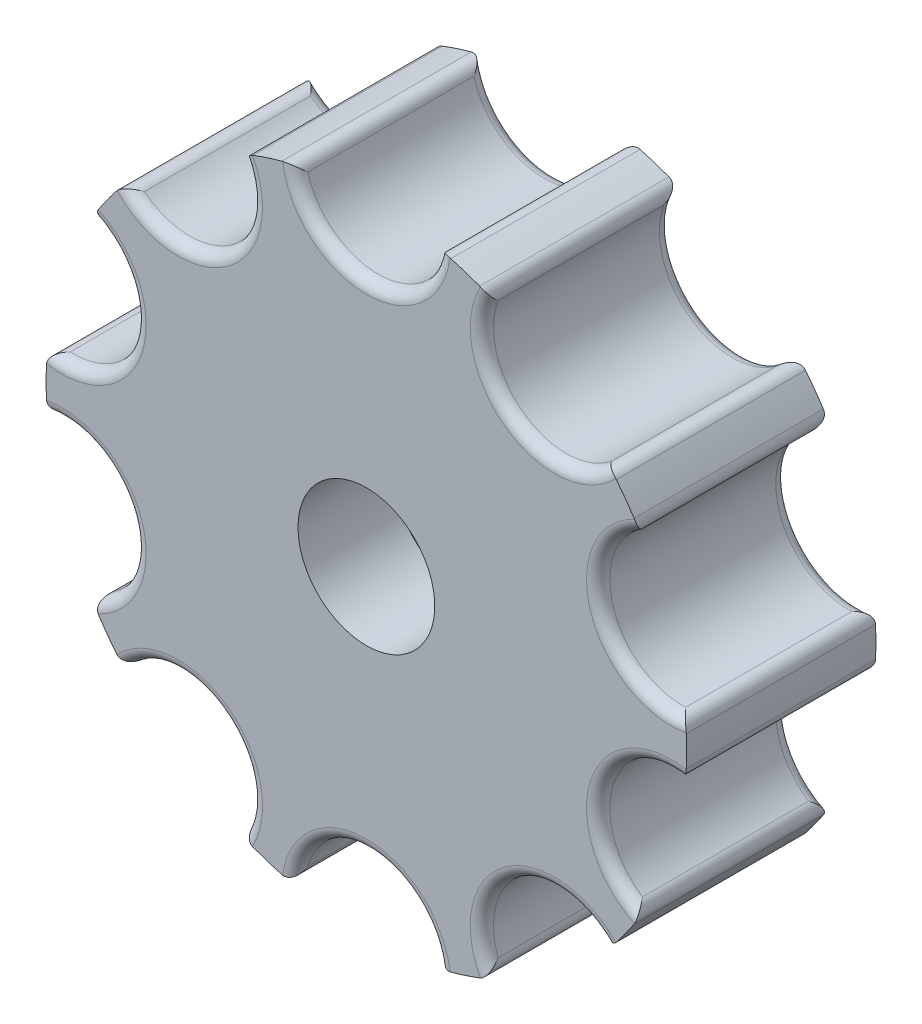
from build123d import *

# Parameters (mm, degrees)
SKETCH1_R           = 11
SKETCH1_R_2         = 2.35
BOSS_EXTRUDE1_DEPTH = 6.5
SKETCH2_R           = 2.5
CUT_EXTRUDE1_DEPTH  = 7.5
FILLET1_R           = 0.4
CUT_EXTRUDE2_DEPTH  = 3.2


with BuildPart() as part:
    # Sketch1 → Boss-Extrude1 (new body)
    with BuildSketch(Plane.XY):
        Circle(SKETCH1_R)
        Circle(SKETCH1_R_2, mode=Mode.SUBTRACT)
    extrude(amount=BOSS_EXTRUDE1_DEPTH)

    # Sketch2 → Cut-Extrude1 (cut)
    with BuildSketch(Plane.XY.offset(6.5)):
        with Locations((0, -11)):
            Circle(SKETCH2_R)
        with Locations((-6.465637775, -8.899186938)):
            Circle(SKETCH2_R)
        with Locations((-10.461621679, -3.399186938)):
            Circle(SKETCH2_R)
        with Locations((-10.461621679, 3.399186938)):
            Circle(SKETCH2_R)
        with Locations((-6.465637775, 8.899186938)):
            Circle(SKETCH2_R)
        with Locations((0, 11)):
            Circle(SKETCH2_R)
        with Locations((6.465637775, 8.899186938)):
            Circle(SKETCH2_R)
        with Locations((10.461621679, 3.399186938)):
            Circle(SKETCH2_R)
        with Locations((10.461621679, -3.399186938)):
            Circle(SKETCH2_R)
        with Locations((6.465637775, -8.899186938)):
            Circle(SKETCH2_R)
    extrude(amount=-CUT_EXTRUDE1_DEPTH, mode=Mode.SUBTRACT)

    # Fillet1
    fillet1_edges = [part.edges().sort_by_distance(p)[0] for p in [
        (-9.423896897, 5.673637922, 3.25),
        (-8.083980389, 2.626644452, 6.5),
        (-10.95897344, 0.949158117, 3.25),
        (-8.083980389, 2.626644452, 0),
        (-4.289212046, 10.129297114, 3.25),
        (-4.996174644, 6.876644452, 6.5),
        (-8.308094611, 7.209408015, 3.25),
        (-4.996174644, 6.876644452, 0),
        (2.483806022, 10.715909091, 3.25),
        (0, 8.5, 6.5),
        (-2.483806022, 10.715909091, 3.25),
        (0, 8.5, 0),
        (10.95897344, 0.949158117, 3.25),
        (8.083980389, 2.626644452, 6.5),
        (9.423896897, 5.673637922, 3.25),
        (8.083980389, 2.626644452, 0),
        (9.423896897, -5.673637922, 3.25),
        (8.083980389, -2.626644452, 6.5),
        (10.95897344, -0.949158117, 3.25),
        (8.083980389, -2.626644452, 0),
        (4.289212046, -10.129297114, 3.25),
        (4.996174644, -6.876644452, 6.5),
        (8.308094611, -7.209408015, 3.25),
        (4.996174644, -6.876644452, 0),
        (8.308094611, 7.209408015, 3.25),
        (4.996174644, 6.876644452, 6.5),
        (4.289212046, 10.129297114, 3.25),
        (4.996174644, 6.876644452, 0),
        (-2.483806022, -10.715909091, 3.25),
        (0, -8.5, 6.5),
        (2.483806022, -10.715909091, 3.25),
        (0, -8.5, 0),
        (-8.308094611, -7.209408015, 3.25),
        (-4.996174644, -6.876644452, 6.5),
        (-4.289212046, -10.129297114, 3.25),
        (-4.996174644, -6.876644452, 0),
        (-10.95897344, -0.949158117, 3.25),
        (-8.083980389, -2.626644452, 6.5),
        (-9.423896897, -5.673637922, 3.25),
        (-8.083980389, -2.626644452, 0),
    ]]
    fillet(fillet1_edges, radius=FILLET1_R)

    # Sketch3 → Cut-Extrude2 (cut)
    with BuildSketch(Plane(origin=(0, 0, 0), x_dir=(-1, 0, 0), z_dir=(0, 0, -1))):
        Polygon((4.330127019, 0), (2.165063509, 3.75), (-2.165063509, 3.75), (-4.330127019, 0), (-2.165063509, -3.75), (2.165063509, -3.75), align=None)
    extrude(amount=-CUT_EXTRUDE2_DEPTH, mode=Mode.SUBTRACT)


solid = part.part
